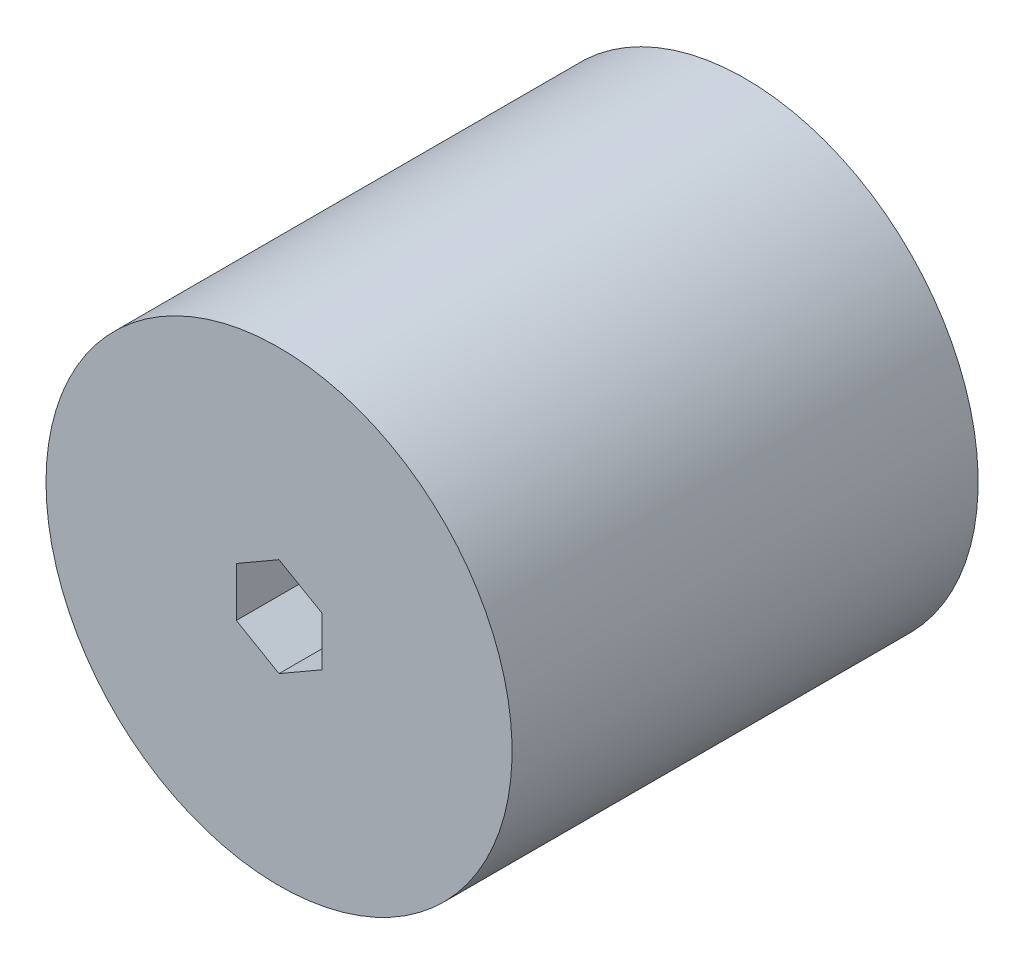
from build123d import *

# Parameters (mm, degrees)
SKETCH1_R           = 38.1
BOSS_EXTRUDE1_DEPTH = 76.2


with BuildPart() as part:
    # Sketch1 → Boss-Extrude1 (new body)
    with BuildSketch(Plane.XY):
        Circle(SKETCH1_R)
        Polygon((0, 8.065583261), (-6.985, 4.03279163), (-6.985, -4.03279163), (0, -8.065583261), (6.985, -4.03279163), (6.985, 4.03279163), align=None, mode=Mode.SUBTRACT)
    extrude(amount=BOSS_EXTRUDE1_DEPTH)


solid = part.part
